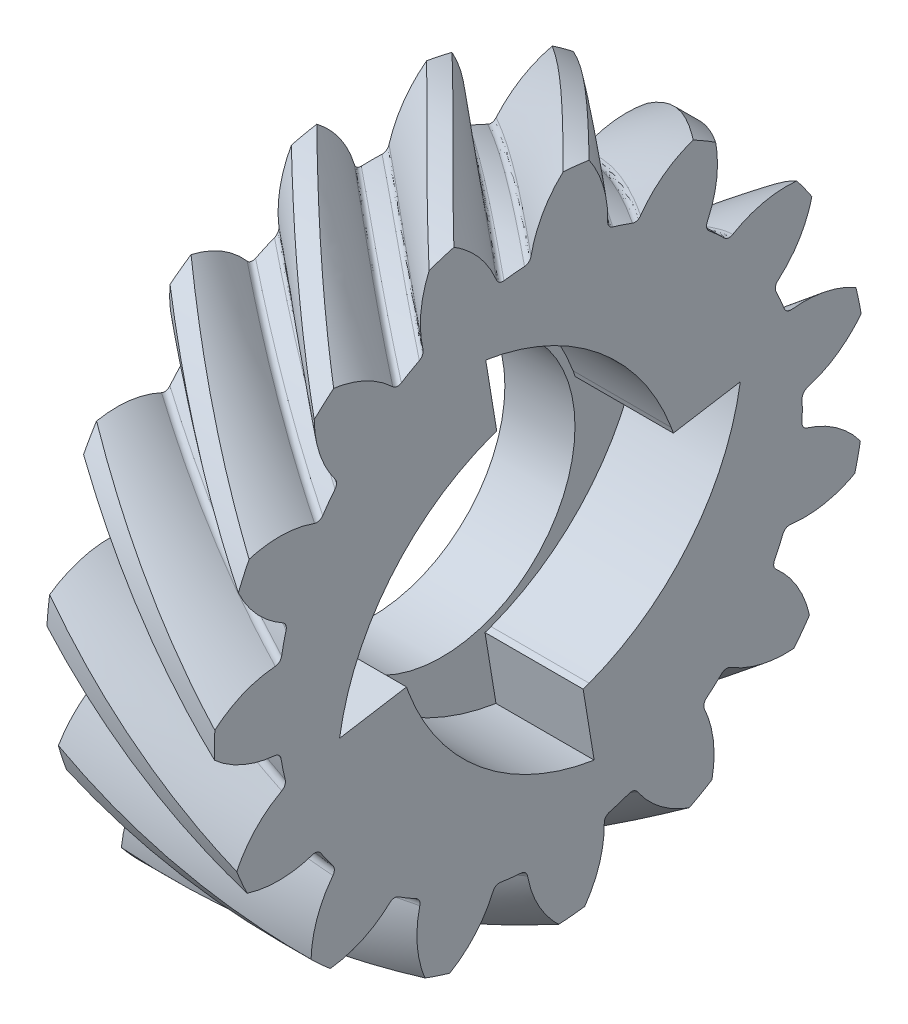
from build123d import *

# Parameters (mm, degrees)
BASPROSKE_W            = 12
BASPROSKE_H            = 23.213203436
TOOTHCUTRH_PITCH       = 145.852858759
TOOTHCUTRH_HEIGHT      = 12
TOOTHCUTRH_RADIUS      = 23.213203436
TOOTHCUTRH_START_ANGLE = -90
TEETHCUTSRH_COUNT      = 15
TEETHCUTSRH_ANGLE      = 336
BORSKE_R               = 9.5
BORE_DEPTH             = 62.5000025
CUT_EXTRUDE1_DEPTH     = 7


with BuildPart() as part:
    # BasProSke → Base-Revolve (revolve)
    with BuildSketch(Plane(origin=(0, 0, 0), x_dir=(1, 0, 0), z_dir=(0, 1, 0)), mode=Mode.PRIVATE) as base_revolve_sk:
        with Locations((6, 11.606601718)):
            Rectangle(BASPROSKE_W, BASPROSKE_H)
    revolve(base_revolve_sk.sketch.rotate(Axis((-10, 0, 0), (1, 0, 0)), 180), axis=Axis((-10, 0, 0), (1, 0, 0)))

    # ToothCutRH: sweep along a helix
    with BuildLine() as toothcutrh_path:
        add(Helix(TOOTHCUTRH_PITCH, TOOTHCUTRH_HEIGHT, TOOTHCUTRH_RADIUS, center=(0, 0, 0), direction=(1, 0, 0), mode=Mode.PRIVATE).rotate(Axis((0, 0, 0), (1, 0, 0)), TOOTHCUTRH_START_ANGLE))
    # TooCutSkeRH → ToothCutRH (sweep, cut)
    with BuildSketch(Plane(origin=(0, 0, 0), x_dir=(0, 0, -1), z_dir=(1, 0, 0))):
        with BuildLine():
            ThreePointArc((0.737932466, 18.698648039), (0, 18.713203436), (-0.737932466, 18.698648039))
            ThreePointArc((-0.737932466, 18.698648039), (-1.048225915, 18.791104975), (-1.237176833, 19.05402675))
            ThreePointArc((-1.237176833, 19.05402675), (-2.574531721, 21.584927745), (-4.762692437, 23.430444103))
            ThreePointArc((-4.762692437, 23.430444103), (0, 23.909599539), (4.762692437, 23.430444103))
            ThreePointArc((4.762692437, 23.430444103), (2.574531721, 21.584927745), (1.237176833, 19.05402675))
            ThreePointArc((1.237176833, 19.05402675), (1.048225915, 18.791104975), (0.737932466, 18.698648039))
        make_face()
    toothcutrh = sweep(path=toothcutrh_path.line, is_frenet=True, mode=Mode.SUBTRACT)

    # TeethCutsRH: ToothCutRH ×15 about axis
    teethcutsrh_axis = Axis((-10, 0, 0), (1, 0, 0))
    for i in range(1, TEETHCUTSRH_COUNT):
        add(toothcutrh.rotate(teethcutsrh_axis, i * TEETHCUTSRH_ANGLE / (TEETHCUTSRH_COUNT - 1)), mode=Mode.SUBTRACT)

    # BorSke → Bore (cut, symmetric)
    with BuildSketch(Plane(origin=(0, 0, 0), x_dir=(0, 0, -1), z_dir=(1, 0, 0))):
        with Locations(Location((0, 0, 0), (0, 0, 180))):
            Circle(BORSKE_R)
    extrude(amount=BORE_DEPTH, both=True, mode=Mode.SUBTRACT)

    # Sketch3 → Cut-Extrude1 (cut)
    with BuildSketch(Plane(origin=(12, 0, 0), x_dir=(0, 0, -1), z_dir=(1, 0, 0))):
        with BuildLine():
            Line((-3.865486012, 14.290072259), (-3.081491947, 9.513380439))
            ThreePointArc((-3.081491947, 9.513380439), (-3.297792107, 9.440580873), (-3.512374595, 9.362864129))
            ThreePointArc((-3.512374595, 9.362864129), (-10.689940745, 4.206032889), (-14.290072259, -3.865486012))
            Line((-14.290072259, -3.865486012), (-9.513380439, -3.081491947))
            ThreePointArc((-9.513380439, -3.081491947), (-9.440580873, -3.297792107), (-9.362864129, -3.512374595))
            ThreePointArc((-9.362864129, -3.512374595), (-4.206032889, -10.689940745), (3.865486012, -14.290072259))
            Line((3.865486012, -14.290072259), (3.081491947, -9.513380439))
            ThreePointArc((3.081491947, -9.513380439), (3.297792107, -9.440580873), (3.512374595, -9.362864129))
            ThreePointArc((3.512374595, -9.362864129), (10.689940745, -4.206032889), (14.290072259, 3.865486012))
            Line((14.290072259, 3.865486012), (9.513380439, 3.081491947))
            ThreePointArc((9.513380439, 3.081491947), (9.440580873, 3.297792107), (9.362864129, 3.512374595))
            ThreePointArc((9.362864129, 3.512374595), (4.206032889, 10.689940745), (-3.865486012, 14.290072259))
        make_face()
    extrude(amount=-CUT_EXTRUDE1_DEPTH, mode=Mode.SUBTRACT)


solid = part.part
